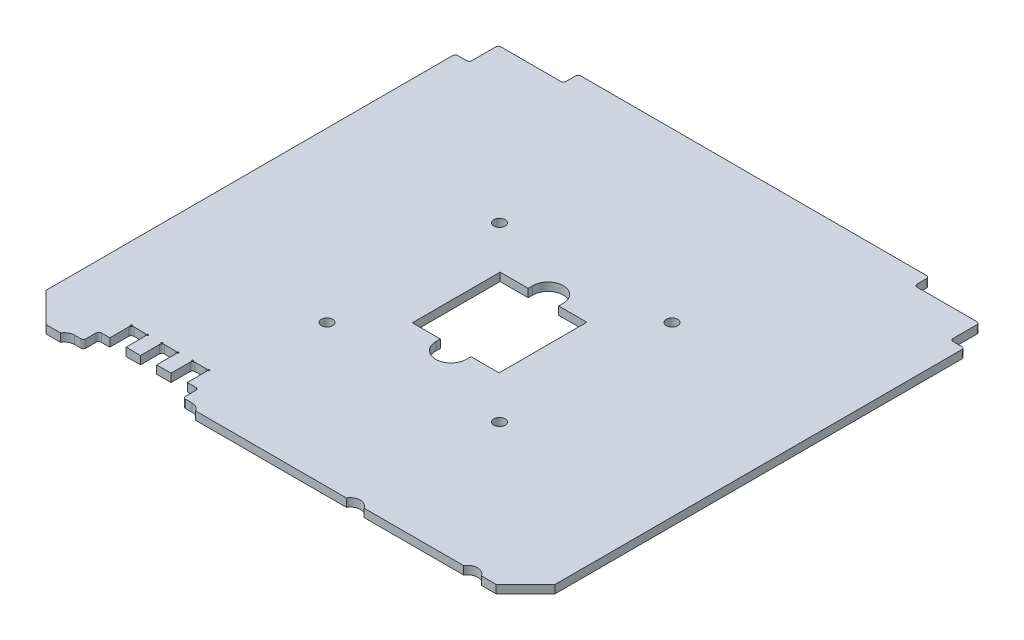
from build123d import *

# Parameters (mm, degrees)
GENERICCARDPCBDEFINITION_FILLET3_START   = -0.8
GENERICCARDPCBDEFINITION_FILLET3_OUTLI_R = 0.16
GENERICCARDPCBDEFINITION_FILLET3_DEPTH   = 1.6
SKETCH1_R                                = 1.1
CUT_EXTRUDE1_DEPTH                       = 10


# Read off the part's stored shape, not the designer's step: <GenericCardPCBDefinition>-<Fillet3>
with BuildPart() as part:
    # <GenericCardPCBDefinition>-<Fillet3> outli → <GenericCardPCBDefinition>-<Fillet3> (new body)
    with BuildSketch(Plane(origin=(0, 0, 0), x_dir=(1, 0, 0), z_dir=(0, 1, 0)).offset(GENERICCARDPCBDEFINITION_FILLET3_START)):
        with BuildLine():
            ThreePointArc((-41.232050808, -44.8), (-40.5, -44.067949192), (-39.5, -43.8))
            Line((-39.5, -43.8), (-38.267949192, -43.8))
            ThreePointArc((-38.267949192, -43.8), (-37.914395801, -43.653553391), (-37.767949192, -43.3))
            Line((-37.767949192, -43.3), (-37.767949192, -41.3))
            ThreePointArc((-37.767949192, -41.3), (-37.621502583, -40.946446609), (-37.267949192, -40.8))
            Line((-37.267949192, -40.8), (-35.59, -40.8))
            Line((-35.59, -40.8), (-35.59, -37.1))
            ThreePointArc((-35.59, -37.1), (-35.443553391, -36.746446609), (-35.09, -36.6))
            Line((-35.09, -36.6), (-32.91, -36.6))
            ThreePointArc((-32.91, -36.6), (-32.556446609, -36.746446609), (-32.41, -37.1))
            Line((-32.41, -37.1), (-32.41, -40.8))
            Line((-32.41, -40.8), (-29.59, -40.8))
            Line((-29.59, -40.8), (-29.59, -37.1))
            ThreePointArc((-29.59, -37.1), (-29.443553391, -36.746446609), (-29.09, -36.6))
            Line((-29.09, -36.6), (-26.91, -36.6))
            ThreePointArc((-26.91, -36.6), (-26.556446609, -36.746446609), (-26.41, -37.1))
            Line((-26.41, -37.1), (-26.41, -40.8))
            Line((-26.41, -40.8), (-23.59, -40.8))
            Line((-23.59, -40.8), (-23.59, -37.1))
            ThreePointArc((-23.59, -37.1), (-23.443553391, -36.746446609), (-23.09, -36.6))
            Line((-23.09, -36.6), (-20.91, -36.6))
            ThreePointArc((-20.91, -36.6), (-20.556446609, -36.746446609), (-20.41, -37.1))
            Line((-20.41, -37.1), (-20.41, -40.8))
            Line((-20.41, -40.8), (-18.732050808, -40.8))
            ThreePointArc((-18.732050808, -40.8), (-18.378497417, -40.946446609), (-18.232050808, -41.3))
            Line((-18.232050808, -41.3), (-18.232050808, -43.3))
            ThreePointArc((-18.232050808, -43.3), (-18.085604199, -43.653553391), (-17.732050808, -43.8))
            Line((-17.732050808, -43.8), (-16.5, -43.8))
            ThreePointArc((-16.5, -43.8), (-15.5, -44.067949192), (-14.767949192, -44.8))
            Line((-14.767949192, -44.8), (14.767949192, -44.8))
            ThreePointArc((14.767949192, -44.8), (16.5, -43.8), (18.232050808, -44.8))
            Line((18.232050808, -44.8), (37.767949192, -44.8))
            ThreePointArc((37.767949192, -44.8), (39.5, -43.8), (41.232050808, -44.8))
            Line((41.232050808, -44.8), (44.1, -44.8))
            Line((44.1, -44.8), (49.9, -39))
            Line((49.9, -39), (49.9, 40.7))
            ThreePointArc((49.9, 40.7), (49.753553391, 41.053553391), (49.4, 41.2))
            Line((49.4, 41.2), (47.65, 41.2))
            ThreePointArc((47.65, 41.2), (47.296446609, 41.346446609), (47.15, 41.7))
            Line((47.15, 41.7), (47.15, 46.4))
            ThreePointArc((47.15, 46.4), (47.003553391, 46.753553391), (46.65, 46.9))
            Line((46.65, 46.9), (34.9, 46.9))
            ThreePointArc((34.9, 46.9), (34.546446609, 47.046446609), (34.4, 47.4))
            Line((34.4, 47.4), (34.4, 49.3))
            ThreePointArc((34.4, 49.3), (34.253553391, 49.653553391), (33.9, 49.8))
            Line((33.9, 49.8), (-33.9, 49.8))
            ThreePointArc((-33.9, 49.8), (-34.253553391, 49.653553391), (-34.4, 49.3))
            Line((-34.4, 49.3), (-34.4, 47.4))
            ThreePointArc((-34.4, 47.4), (-34.546446609, 47.046446609), (-34.9, 46.9))
            Line((-34.9, 46.9), (-46.65, 46.9))
            ThreePointArc((-46.65, 46.9), (-47.003553391, 46.753553391), (-47.15, 46.4))
            Line((-47.15, 46.4), (-47.15, 41.7))
            ThreePointArc((-47.15, 41.7), (-47.296446609, 41.346446609), (-47.65, 41.2))
            Line((-47.65, 41.2), (-49.4, 41.2))
            ThreePointArc((-49.4, 41.2), (-49.753553391, 41.053553391), (-49.9, 40.7))
            Line((-49.9, 40.7), (-49.9, -39))
            Line((-49.9, -39), (-44.1, -44.8))
            Line((-44.1, -44.8), (-41.232050808, -44.8))
        make_face()
        with Locations((-35.59, -36.6)):
            Circle(GENERICCARDPCBDEFINITION_FILLET3_OUTLI_R, mode=Mode.SUBTRACT)
        with Locations((-32.41, -36.6)):
            Circle(GENERICCARDPCBDEFINITION_FILLET3_OUTLI_R, mode=Mode.SUBTRACT)
        with Locations((-29.59, -36.6)):
            Circle(GENERICCARDPCBDEFINITION_FILLET3_OUTLI_R, mode=Mode.SUBTRACT)
        with Locations((-26.41, -36.6)):
            Circle(GENERICCARDPCBDEFINITION_FILLET3_OUTLI_R, mode=Mode.SUBTRACT)
        with Locations((-23.59, -36.6)):
            Circle(GENERICCARDPCBDEFINITION_FILLET3_OUTLI_R, mode=Mode.SUBTRACT)
        with Locations((-20.41, -36.6)):
            Circle(GENERICCARDPCBDEFINITION_FILLET3_OUTLI_R, mode=Mode.SUBTRACT)
    extrude(amount=GENERICCARDPCBDEFINITION_FILLET3_DEPTH)

    # Sketch1 → Cut-Extrude1 (cut)
    with BuildSketch(Plane(origin=(0, 0.8, 0), x_dir=(1, 0, 0), z_dir=(0, 1, 0))):
        with Locations(Location((16.891859219, -16.911976124, 0), (0, 0, 270))):
            Circle(SKETCH1_R)
        with Locations(Location((16.891859219, 16.888023876, 0), (0, 0, 270))):
            Circle(SKETCH1_R)
        with Locations(Location((-16.908140781, -16.911976124, 0), (0, 0, 270))):
            Circle(SKETCH1_R)
        with Locations(Location((-16.908140781, 16.888023876, 0), (0, 0, 270))):
            Circle(SKETCH1_R)
        with BuildLine():
            Line((8.506216867, -8.611976124), (3, -8.611976124))
            Line((3, -8.611976124), (3, -9.511976124))
            ThreePointArc((3, -9.511976124), (-0.000900642, -12.511975988), (-2.999999459, -9.51017484))
            Line((-2.999999459, -9.51017484), (-2.997060521, -8.611976124))
            Line((-2.997060521, -8.611976124), (-8.493783133, -8.611976124))
            Line((-8.493783133, -8.611976124), (-8.493783133, 8.588023876))
            Line((-8.493783133, 8.588023876), (-3, 8.588023876))
            Line((-3, 8.588023876), (-3, 9.488023876))
            ThreePointArc((-3, 9.488023876), (0, 12.488023876), (3, 9.488023876))
            Line((3, 9.488023876), (3, 8.588023876))
            Line((3, 8.588023876), (8.506216867, 8.588023876))
            Line((8.506216867, 8.588023876), (8.506216867, -8.611976124))
        make_face()
    extrude(amount=-CUT_EXTRUDE1_DEPTH, mode=Mode.SUBTRACT)


solid = part.part
